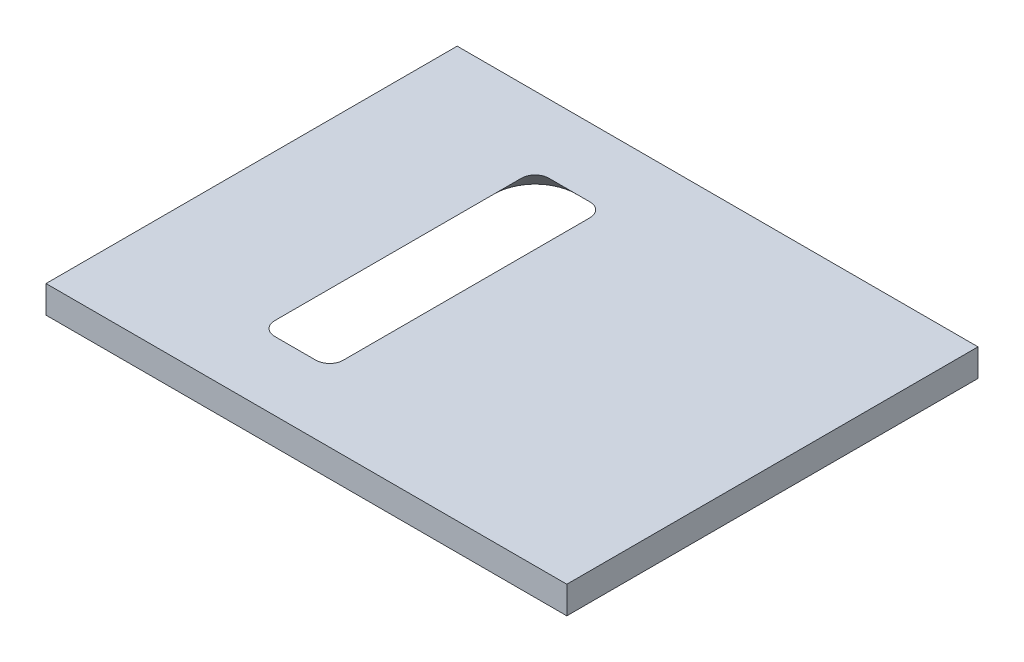
from build123d import *

# Parameters (mm, degrees)
SKETCH2_W           = 38
SKETCH2_H           = 30
BOSS_EXTRUDE1_DEPTH = 2
CUT_EXTRUDE4_DEPTH  = 30.061781566
CUT_EXTRUDE4_DRAFT  = 45


with BuildPart() as part:
    # Sketch2 → Boss-Extrude1 (new body)
    with BuildSketch(Plane(origin=(0, 0, 0), x_dir=(1, 0, 0), z_dir=(0, 1, 0))):
        with Locations((5.811028754, 0)):
            Rectangle(SKETCH2_W, SKETCH2_H)
    extrude(amount=BOSS_EXTRUDE1_DEPTH)


with BuildPart() as cut_extrude4_tool:
    # Sketch4 → Cut-Extrude4 (with draft: the straight prism first)
    with BuildSketch(Plane(origin=(0, 2, 0), x_dir=(1, 0, 0), z_dir=(0, 1, 0))):
        with BuildLine():
            ThreePointArc((1.5, -10), (2.207106781, -9.707106781), (2.5, -9))
            Line((2.5, -9), (2.5, 9))
            ThreePointArc((2.5, 9), (2.207106781, 9.707106781), (1.5, 10))
            Line((1.5, 10), (-1.5, 10))
            ThreePointArc((-1.5, 10), (-2.207106781, 9.707106781), (-2.5, 9))
            Line((-2.5, 9), (-2.5, -9))
            ThreePointArc((-2.5, -9), (-2.207106781, -9.707106781), (-1.5, -10))
            Line((-1.5, -10), (1.5, -10))
        make_face()
    extrude(amount=-CUT_EXTRUDE4_DEPTH)
    # Cut-Extrude4: the draft: its side faces are tilted about the plane it starts from
    cut_extrude4_sides = [cut_extrude4_tool.faces().sort_by_distance(p)[0] for p in [
        (-2.207106781, -13.030890783, 9.707106781),
        (0, -13.030890783, 10),
        (2.207106781, -13.030890783, 9.707106781),
        (2.5, -13.030890783, 0),
        (2.207106781, -13.030890783, -9.707106781),
        (0, -13.030890783, -10),
        (-2.207106781, -13.030890783, -9.707106781),
        (-2.5, -13.030890783, 0),
    ]]
    draft(cut_extrude4_sides, Plane(origin=(0, 2, 0), x_dir=(1, 0, 0), z_dir=(0, 1, 0)), CUT_EXTRUDE4_DRAFT)


with BuildPart() as part_1:
    add(part.part)

    # Cut-Extrude4: cut by cut_extrude4_tool
    add(cut_extrude4_tool.part, mode=Mode.SUBTRACT)


solid = part_1.part
